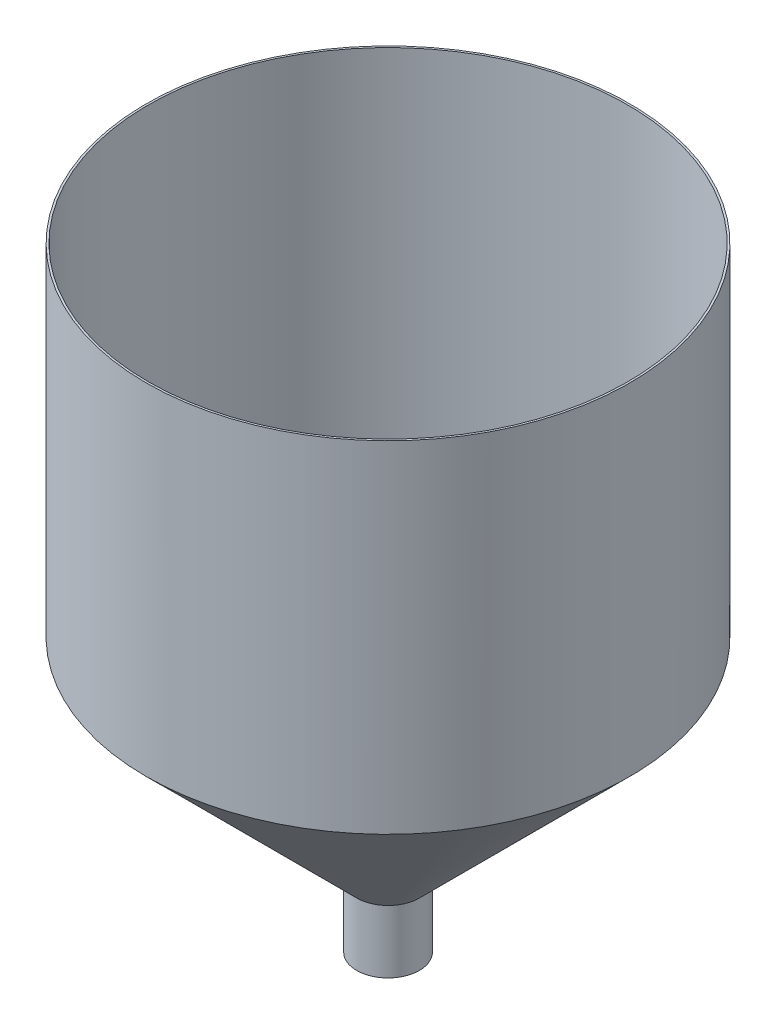
from build123d import *

# Parameters (mm, degrees)
CROQUIS1_R              = 385.3
SALIENTE_EXTRUIR1_DEPTH = 543.2
CROQUIS3_R              = 50
CROQUIS2_R              = 385.3
CROQUIS4_R              = 50
SALIENTE_EXTRUIR2_DEPTH = 100


# Read off the part's stored shape, not the designer's step: Vaciado1
with BuildPart() as part:
    # Croquis1 → Saliente-Extruir1 (new body)
    with BuildSketch(Plane(origin=(0, 0, 0), x_dir=(1, 0, 0), z_dir=(0, 1, 0))):
        with Locations(Location((0, 0, 0), (0, 0, 270))):
            Circle(CROQUIS1_R)
    extrude(amount=-SALIENTE_EXTRUIR1_DEPTH)

    # Croquis3 → Recubrir1 section 0
    with BuildSketch(Plane(origin=(0, -878.5, 0), x_dir=(1, 0, 0), z_dir=(0, 1, 0))):
        Circle(CROQUIS3_R)
    # Croquis2 → Recubrir1 section 1
    with BuildSketch(Plane.XZ.offset(543.2)):
        Circle(CROQUIS2_R)
    loft()

    # Croquis4 → Saliente-Extruir2 (add)
    with BuildSketch(Plane.XZ.offset(878.5)):
        with Locations(Location((0, 0, 0), (0, 0, 270))):
            Circle(CROQUIS4_R)
    extrude(amount=SALIENTE_EXTRUIR2_DEPTH)

    # Vaciado1 outline → Vaciado1 (revolve, cut)
    with BuildSketch(Plane.XY):
        Polygon((382.125, -541.884871939), (382.125, 0), (0, 0), (0, -978.5), (46.825, -978.5), (46.825, -877.184871939), align=None)
    revolve(axis=Axis((0, 0, 0), (0, 1, 0)), mode=Mode.SUBTRACT)


solid = part.part
